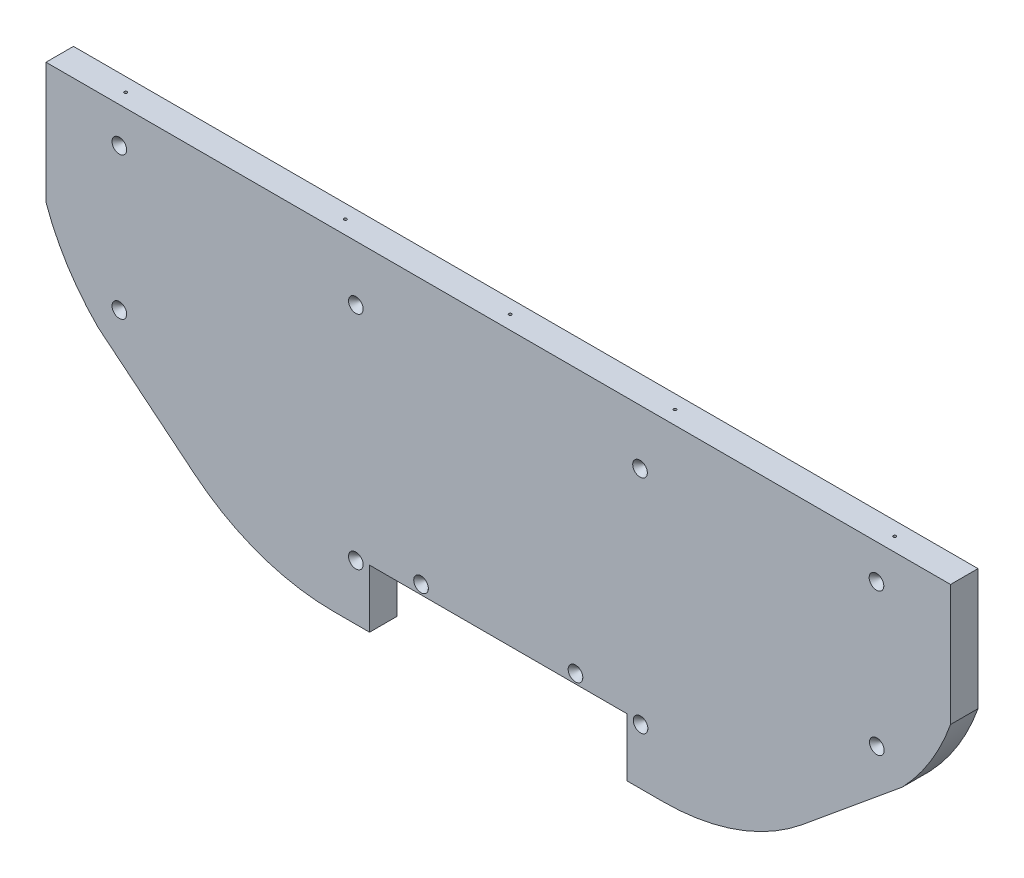
from build123d import *

# Parameters (mm, degrees)
BOSS_EXTRUDE1_DEPTH                       = 19.05
F_5_64_0_07813_DIAMETER_HOLE1_D           = 1.984502
F_5_64_0_07813_DIAMETER_HOLE1_DEPTH       = 38.1
F_5_64_0_07813_DIAMETER_HOLE1_CSINK_D     = 10.16
F_5_64_0_07813_DIAMETER_HOLE1_CSINK_ANGLE = 82
F_5_64_0_07813_DIAMETER_HOLE1_TIP         = 0.59620455
F_5_64_0_07813_DIAMETER_HOLE2_D           = 1.984502
F_5_64_0_07813_DIAMETER_HOLE2_DEPTH       = 38.1
F_5_64_0_07813_DIAMETER_HOLE2_CSINK_D     = 10.16
F_5_64_0_07813_DIAMETER_HOLE2_CSINK_ANGLE = 82
F_5_64_0_07813_DIAMETER_HOLE2_TIP         = 0.59620455
CUT_EXTRUDE1_REACH                        = 1050.231
SKETCH6_W                                 = 178.5366
SKETCH6_H                                 = 40.3225


with BuildPart() as part:
    # Sketch1 → Boss-Extrude1 (new body)
    with BuildSketch(Plane.XY):
        with BuildLine():
            Line((-394.36675, -87.3125), (-394.36675, -3.175))
            Line((-394.36675, -3.175), (-709.32675, -3.175))
            Line((-709.32675, -3.175), (-1021.74675, -3.175))
            Line((-1021.74675, -3.175), (-1021.74675, -87.3125))
            ThreePointArc((-1021.74675, -87.3125), (-1006.860273511, -117.921148224), (-985.55175, -144.4625))
            Line((-985.55175, -144.4625), (-918.739071633, -199.014217805))
            ThreePointArc((-918.739071633, -199.014217805), (-873.516686506, -224.518833531), (-822.35675, -233.3625))
            Line((-822.35675, -233.3625), (-709.32675, -233.3625))
            Line((-709.32675, -233.3625), (-593.75675, -233.3625))
            ThreePointArc((-593.75675, -233.3625), (-542.596813494, -224.518833531), (-497.374428367, -199.014217805))
            Line((-497.374428367, -199.014217805), (-427.75505, -141.598056338))
            ThreePointArc((-427.75505, -141.598056338), (-408.191508181, -116.220095946), (-394.36675, -87.3125))
        make_face()
    extrude(amount=BOSS_EXTRUDE1_DEPTH)

    # 5/64 (0.07813) Diameter Hole1
    with Locations(Plane(origin=(-708.05675, 15.875, 6128.559863233), x_dir=(1, 0, 0), z_dir=(0, 1, 0))):
        with Locations((-262.8265, 6157.452363233), (-98.7933, 6157.452363233), (-262.8265, 6233.652363233), (-98.7933, 6233.652363233), (-262.8265, 6309.852363233), (-98.7933, 6309.852363233), (-267.97, 6119.034863233), (-115.57, 6119.034863233), (-1.27, 6119.034863233), (113.03, 6119.034863233), (265.43, 6119.034863233), (96.2533, 6309.852363233), (260.2865, 6309.852363233), (96.2533, 6233.652363233), (260.2865, 6233.652363233), (96.2533, 6157.452363233), (260.2865, 6157.452363233)):
            CounterSinkHole(F_5_64_0_07813_DIAMETER_HOLE1_D / 2, F_5_64_0_07813_DIAMETER_HOLE1_CSINK_D / 2, depth=F_5_64_0_07813_DIAMETER_HOLE1_DEPTH, counter_sink_angle=F_5_64_0_07813_DIAMETER_HOLE1_CSINK_ANGLE)
            with Locations((0, 0, -(F_5_64_0_07813_DIAMETER_HOLE1_DEPTH + F_5_64_0_07813_DIAMETER_HOLE1_TIP / 2))):  # 118° drill point
                Cone(0, F_5_64_0_07813_DIAMETER_HOLE1_D / 2, F_5_64_0_07813_DIAMETER_HOLE1_TIP, mode=Mode.SUBTRACT)

    # 5/64 (0.07813) Diameter Hole2
    with Locations(Plane(origin=(-708.05675, 1936.853954382, 19.05), x_dir=(-1, 0, 0), z_dir=(0, 0, 1))):
        with Locations((-262.329795984, 1964.075198497), (262.8265, 1964.708862949), (262.8265, 2063.428497217), (98.7933, 2131.851871048), (98.7933, 1978.393537715), (53.56098, 2123.543954382), (-53.56098, 2123.543954382), (-98.330098001, 1978.155684545), (-98.700429462, 2131.613571028), (-262.568029943, 2062.794545307)):
            CounterSinkHole(F_5_64_0_07813_DIAMETER_HOLE2_D / 2, F_5_64_0_07813_DIAMETER_HOLE2_CSINK_D / 2, depth=F_5_64_0_07813_DIAMETER_HOLE2_DEPTH, counter_sink_angle=F_5_64_0_07813_DIAMETER_HOLE2_CSINK_ANGLE)
            with Locations((0, 0, -(F_5_64_0_07813_DIAMETER_HOLE2_DEPTH + F_5_64_0_07813_DIAMETER_HOLE2_TIP / 2))):  # 118° drill point
                Cone(0, F_5_64_0_07813_DIAMETER_HOLE2_D / 2, F_5_64_0_07813_DIAMETER_HOLE2_TIP, mode=Mode.SUBTRACT)

    # Sketch6 → Cut-Extrude1 (cut, up to next)
    with BuildSketch(Plane(origin=(0, 0, 0), x_dir=(-1, 0, 0), z_dir=(0, 0, -1)), mode=Mode.PRIVATE) as cut_extrude1_sk1:
        with Locations((708.05675, -213.20125)):
            Rectangle(SKETCH6_W, SKETCH6_H)
    cut_extrude1_tool1 = extrude(cut_extrude1_sk1.sketch, amount=-CUT_EXTRUDE1_REACH, mode=Mode.PRIVATE) & part.part
    add(cut_extrude1_tool1.solids().sort_by_distance((-708.05675, -213.20125, 0))[0], mode=Mode.SUBTRACT)


solid = part.part
